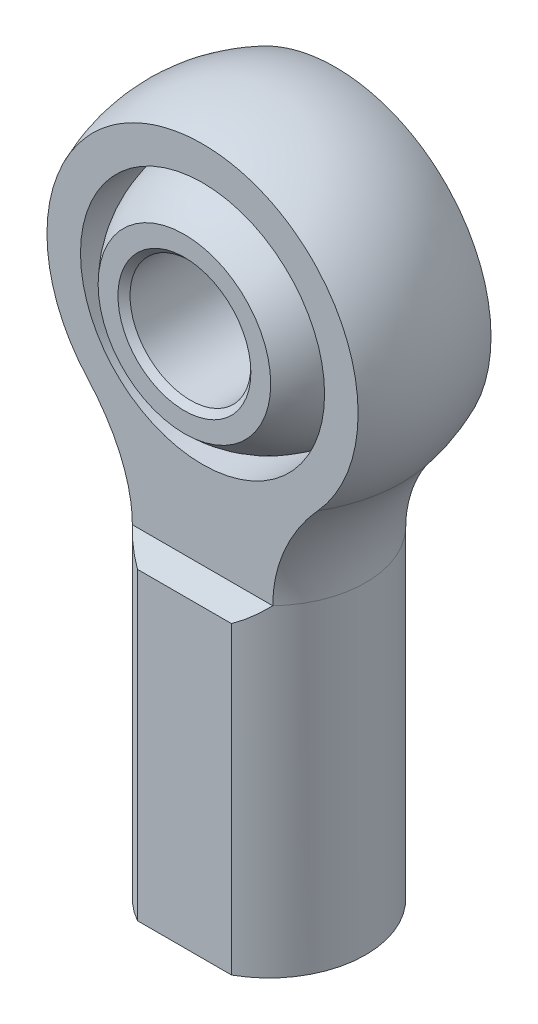
from build123d import *
from OCP.BRepAlgoAPI import BRepAlgoAPI_Cut
from OCP.TopTools import TopTools_ListOfShape

# Parameters (mm, degrees)
SKETCH1_W               = 6.35
SKETCH1_H               = 21.176846715
SKETCH12_W              = 3.96875
SKETCH12_H              = 17.4625
CUT_SWEEP1_PITCH        = 1.058333333
CUT_SWEEP1_FROM         = 0
SKETCH14_W              = 11.0998
SKETCH14_H              = 0.8001
CUT_EXTRUDE5_DEPTH      = 24.002257211
CUT_EXTRUDE1_DEPTH      = 33.611438752
CUT_EXTRUDE1_DEPTH_BACK = 33.611438752
CUT_EXTRUDE2_DEPTH      = 32.157979255
CUT_EXTRUDE2_DEPTH_BACK = 32.157979255
SKETCH6_R               = 8.016875
CUT_EXTRUDE3_DEPTH      = 32.670525532
CUT_EXTRUDE3_DEPTH_BACK = 32.670525532
SKETCH8_W               = 5.55625
SKETCH8_H               = 24.860653285
CUT_EXTRUDE4_DEPTH      = 32.670525532
CUT_EXTRUDE4_DEPTH_BACK = 32.670525532
SKETCH10_R              = 3.96875
CHAMFER1_SIZE           = 0.396875


with BuildPart() as part:
    # Sketch1 → Revolve1 (revolve)
    with BuildSketch(Plane.XY, mode=Mode.PRIVATE) as revolve1_sk:
        with Locations((3.175, -6.874076643)):
            Rectangle(SKETCH1_W, SKETCH1_H)
    revolve(revolve1_sk.sketch.rotate(Axis((0, 28.575, 0), (0, -1, 0)), 180), axis=Axis((0, 28.575, 0), (0, -1, 0)))

    # Sketch14 → Cut-Extrude5 (cut, through all)
    with BuildSketch(Plane(origin=(0, -17.4625, 0), x_dir=(-1, 0, 0), z_dir=(0, 1, 0))):
        with Locations((0, 5.94995)):
            Rectangle(SKETCH14_W, SKETCH14_H)
        with Locations((0, -5.94995)):
            Rectangle(SKETCH14_W, SKETCH14_H)
    extrude(amount=CUT_EXTRUDE5_DEPTH, mode=Mode.SUBTRACT)


with BuildPart() as body_2:
    # Sketch12 → Revolve4 (revolve)
    with BuildSketch(Plane.XY):
        with Locations((1.984375, -8.73125)):
            Rectangle(SKETCH12_W, SKETCH12_H)
    revolve(axis=Axis((0, 0, 0), (0, 1, 0)))

    # Cut-Sweep1: arcs per turn and ends read off the stored shape
    # Cut-Sweep1: the profile of Sketch16 profile screwed along a right-hand helix through 18.5 turns, 8 arcs to a turn; built about Z, then put on its axis
    cut_sweep1_z = Axis((0, 0, 0), (0, 0, 1))
    cut_sweep1_corners = [(3.96905, 0, -1.984548205), (3.96905, 0, -1.058160128), (3.281342336, 0, -1.455208333), (3.281342336, 0, -1.5875)]
    with BuildLine(mode=Mode.PRIVATE) as cut_sweep1_profile:
        Line(cut_sweep1_corners[0], cut_sweep1_corners[1])
        Line(cut_sweep1_corners[1], cut_sweep1_corners[2])
        Line(cut_sweep1_corners[2], cut_sweep1_corners[3])
        Line(cut_sweep1_corners[3], cut_sweep1_corners[0])
    cut_sweep1_cap = Face(cut_sweep1_profile.wire())
    cut_sweep1_turn_angles = [0, 22.5, 45, 67.5, 90, 112.5, 135, 157.5, 180, 202.5, 225, 247.5, 270, 292.5, 315, 337.5, 360]
    cut_sweep1_turn_weights = [1, 0.9238795325112867, 1, 0.9238795325112867, 1, 0.9238795325112867, 1, 0.9238795325112867, 1, 0.9238795325112867, 1, 0.9238795325112867, 1, 0.9238795325112867, 1, 0.9238795325112867, 1]
    cut_sweep1_turn_rails = [Edge.make_bspline([Vector(p[0], p[1], 0).rotate(cut_sweep1_z, cut_sweep1_turn_angles[k]) / cut_sweep1_turn_weights[k] + Vector(0, 0, p[2] + CUT_SWEEP1_PITCH * cut_sweep1_turn_angles[k] / 360) for k in range(17)], [0, 0, 0, 1, 1, 2, 2, 3, 3, 4, 4, 5, 5, 6, 6, 7, 7, 8, 8, 8], 2, cut_sweep1_turn_weights) for p in cut_sweep1_corners]
    cut_sweep1_turn_sides = [Face.make_surface_from_curves(cut_sweep1_turn_rails[p[0]], cut_sweep1_turn_rails[p[1]]) for p in [(0, 1), (1, 2), (2, 3), (3, 0)]]
    cut_sweep1_last_angles = [6480, 6502.5, 6525, 6547.5, 6570, 6592.5, 6615, 6637.5, 6660]
    cut_sweep1_last_weights = [1, 0.9238795325112867, 1, 0.9238795325112867, 1, 0.9238795325112867, 1, 0.9238795325112867, 1]
    cut_sweep1_last_rails = [Edge.make_bspline([Vector(p[0], p[1], 0).rotate(cut_sweep1_z, cut_sweep1_last_angles[k]) / cut_sweep1_last_weights[k] + Vector(0, 0, p[2] + CUT_SWEEP1_PITCH * cut_sweep1_last_angles[k] / 360) for k in range(9)], [0, 0, 0, 1, 1, 2, 2, 3, 3, 4, 4, 4], 2, cut_sweep1_last_weights) for p in cut_sweep1_corners]
    cut_sweep1_last_sides = [Face.make_surface_from_curves(cut_sweep1_last_rails[p[0]], cut_sweep1_last_rails[p[1]]) for p in [(0, 1), (1, 2), (2, 3), (3, 0)]]
    cut_sweep1 = Plane(origin=(0, 0, 0), x_dir=(-1, 0, 0), z_dir=(0, -1, 0)) * split(Solid(Shell([*[p.moved(Location((0, 0, CUT_SWEEP1_PITCH * i))) for i in range(18) for p in cut_sweep1_turn_sides], *cut_sweep1_last_sides, cut_sweep1_cap, cut_sweep1_cap.rotate(cut_sweep1_z, 6660).moved(Location((0, 0, CUT_SWEEP1_PITCH * 6660 / 360)))])), bisect_by=Plane.XY.offset(CUT_SWEEP1_FROM), keep=Keep.TOP, mode=Mode.PRIVATE)
    add(cut_sweep1, mode=Mode.SUBTRACT)


with BuildPart() as part_1:
    add(part.part)

    # Combine1: cut body 2
    add(body_2.part, mode=Mode.SUBTRACT)

    # Extrude1 cone 1 section (through the dimple's axis) → Extrude1 (revolve, cut)
    with BuildSketch(Plane(origin=(0, -17.4625, 0), x_dir=(0, 0, -1), z_dir=(1, 0, 0))):
        Polygon((0, 0), (4.01955, 0), (0, 4.01955), align=None)
    revolve(axis=Axis((0, -17.4625, 0), (0, 1, 0)), mode=Mode.SUBTRACT)

    # Sketch4 → Revolve2 (revolve)
    with BuildSketch(Plane.XY):
        with BuildLine():
            Line((6.35, 3.714346715), (0, 3.714346715))
            Line((0, 3.714346715), (0, 28.575))
            ThreePointArc((0, 28.575), (9.996895342, 22.315307412), (8.73125, 10.588423357))
            ThreePointArc((8.73125, 10.588423357), (6.962174484, 7.351766173), (6.35, 3.714346715))
        make_face()
    revolve(axis=Axis((0, 28.575, 0), (0, 1, 0)))


with BuildPart() as cut_extrude1_tool:
    # Sketch5 → Cut-Extrude1 (new, two sides: drawn at the far end of the back side and taken through both)
    with BuildSketch(Plane(origin=(0, 0, 0), x_dir=(0, 0, -1), z_dir=(1, 0, 0)).offset(-CUT_EXTRUDE1_DEPTH_BACK)):
        Polygon((4.365625, 28.575), (11.1125, 28.575), (11.1125, 3.714346715), (11.1125, 2.530071715), (5.5499, 2.530071715), (4.365625, 3.714346715), align=None)
        Polygon((-4.365625, 28.575), (-4.365625, 3.714346715), (-5.5499, 2.530071715), (-11.1125, 2.530071715), (-11.1125, 3.714346715), (-11.1125, 28.575), align=None)
    extrude(amount=CUT_EXTRUDE1_DEPTH + CUT_EXTRUDE1_DEPTH_BACK)


with BuildPart() as part_2:
    add(part_1.part)

    # Cut-Extrude1: cut by cut_extrude1_tool, with a tolerance
    cut_extrude1_stock = TopTools_ListOfShape()
    cut_extrude1_stock.Append(part_2.part.wrapped)
    cut_extrude1_tools = TopTools_ListOfShape()
    cut_extrude1_tools.Append(cut_extrude1_tool.part.wrapped)
    cut_extrude1_cut = BRepAlgoAPI_Cut()
    cut_extrude1_cut.SetArguments(cut_extrude1_stock)
    cut_extrude1_cut.SetTools(cut_extrude1_tools)
    cut_extrude1_cut.SetFuzzyValue(0.00001)
    cut_extrude1_cut.Build()
    add(Compound.cast(cut_extrude1_cut.Shape()).solids(), mode=Mode.REPLACE)

    # Sketch6 → Cut-Extrude2 (cut, two sides: drawn at the far end of the back side and taken through both)
    with BuildSketch(Plane.XY.offset(-CUT_EXTRUDE2_DEPTH_BACK)):
        with Locations(Location((0, 17.4625, 0), (0, 0, 270))):
            Circle(SKETCH6_R)
    extrude(amount=CUT_EXTRUDE2_DEPTH + CUT_EXTRUDE2_DEPTH_BACK, mode=Mode.SUBTRACT)


with BuildPart() as body_2_2:
    # Sketch7 → Revolve3 (revolve)
    with BuildSketch(Plane.XY):
        with BuildLine():
            Line((0, 25.4), (0, 9.525))
            ThreePointArc((0, 9.525), (7.9375, 17.4625), (0, 25.4))
        make_face()
    revolve(axis=Axis((0, 0, 0), (0, 1, 0)))

    # Sketch8 → Cut-Extrude3 (cut, two sides: drawn at the far end of the back side and taken through both)
    with BuildSketch(Plane(origin=(0, 0, 0), x_dir=(0, 0, -1), z_dir=(1, 0, 0)).offset(-CUT_EXTRUDE3_DEPTH_BACK)):
        with Locations((-8.334375, 16.144673358)):
            Rectangle(SKETCH8_W, SKETCH8_H)
        with Locations((8.334375, 16.144673358)):
            Rectangle(SKETCH8_W, SKETCH8_H)
    extrude(amount=CUT_EXTRUDE3_DEPTH + CUT_EXTRUDE3_DEPTH_BACK, mode=Mode.SUBTRACT)

    # Sketch10 → Cut-Extrude4 (cut, two sides: drawn at the far end of the back side and taken through both)
    with BuildSketch(Plane.XY.offset(-CUT_EXTRUDE4_DEPTH_BACK)):
        with Locations((0, 17.4625)):
            Circle(SKETCH10_R)
    extrude(amount=CUT_EXTRUDE4_DEPTH + CUT_EXTRUDE4_DEPTH_BACK, mode=Mode.SUBTRACT)

    # Chamfer1
    chamfer1_edges = [body_2_2.edges().sort_by_distance(p)[0] for p in [
        (-3.96875, 17.4625, -5.55625),
        (-3.96875, 17.4625, 5.55625),
    ]]
    chamfer(chamfer1_edges, length=CHAMFER1_SIZE)


solid = Compound([part_2.part, body_2_2.part])
